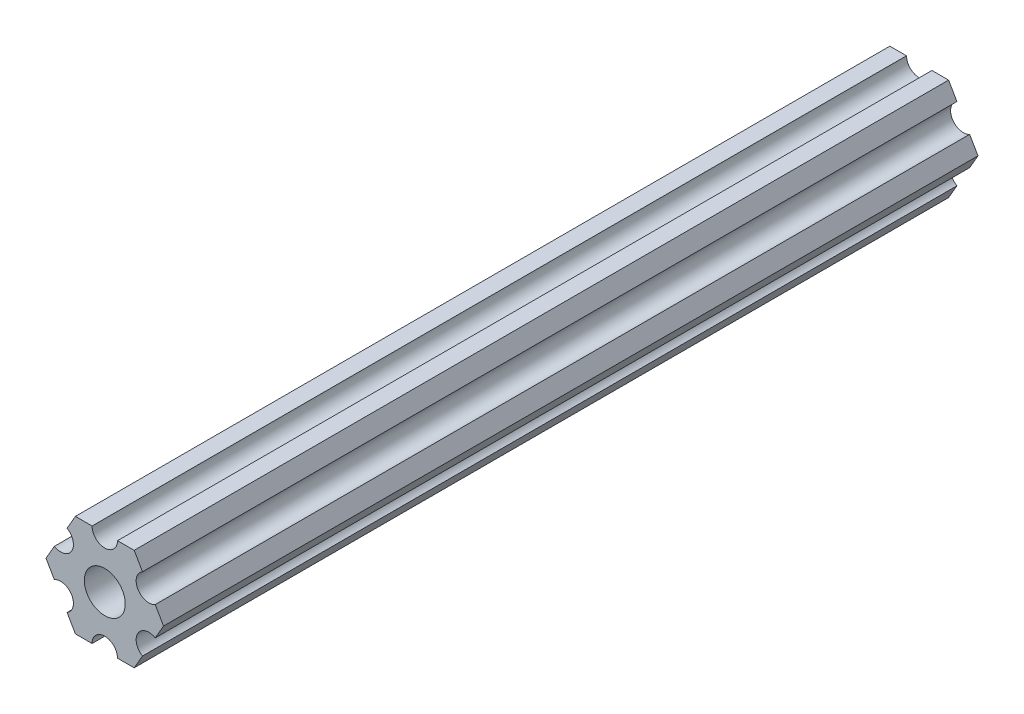
from build123d import *

# Parameters (mm, degrees)
BOSS_EXTRUDE1_DEPTH                         = 101.6
SKETCH2_R                                   = 1.5875
CUT_EXTRUDE1_DEPTH                          = 101.6
CBORE_FOR_10_SOCKET_HEAD_CAP_SCREW2_OUT_R   = 2.5527
CBORE_FOR_10_SOCKET_HEAD_CAP_SCREW2_OUT_R_2 = 1.5875
CBORE_FOR_10_SOCKET_HEAD_CAP_SCREW2_DEPTH   = 101.6


# Read off the part's stored shape, not the designer's step: CBORE for #10 Socket Head Cap Screw2
with BuildPart() as part:
    # Sketch1 → Boss-Extrude1 (new body)
    with BuildSketch(Plane.XY):
        with BuildLine():
            Line((-4.70551159, -4.549815043), (-3.666174521, -6.349999904))
            Line((-3.666174521, -6.349999904), (-1.587501923, -6.349999904))
            ThreePointArc((-1.587501923, -6.349999904), (-3.85e-07, -4.762498365), (1.587501923, -6.349999904))
            Line((1.587501923, -6.349999904), (3.666173825, -6.349999904))
            Line((3.666173825, -6.349999904), (4.705510929, -4.549815232))
            ThreePointArc((4.705510929, -4.549815232), (4.124445601, -2.381249904), (6.293010929, -1.800184575))
            Line((6.293010929, -1.800184575), (7.332348034, 9.6e-08))
            Line((7.332348034, 9.6e-08), (6.293011178, 1.800184715))
            ThreePointArc((6.293011178, 1.800184715), (4.124445902, 2.381250241), (4.705511428, 4.549815516))
            Line((4.705511428, 4.549815516), (3.666174521, 6.350000222))
            Line((3.666174521, 6.350000222), (1.587498077, 6.350000222))
            ThreePointArc((1.587498077, 6.350000222), (3.85e-07, 4.76250253), (-1.587498077, 6.350000222))
            Line((-1.587498077, 6.350000222), (-3.666173825, 6.350000222))
            Line((-3.666173825, 6.350000222), (-4.705511038, 4.549815614))
            ThreePointArc((-4.705511038, 4.549815614), (-4.124445841, 2.38125025), (-6.293011205, 1.800185053))
            Line((-6.293011205, 1.800185053), (-7.332348419, 4.44e-07))
            Line((-7.332348419, 4.44e-07), (-6.293011423, -1.80018429))
            ThreePointArc((-6.293011423, -1.80018429), (-4.12444613, -2.38124975), (-4.70551159, -4.549815043))
        make_face()
    extrude(amount=BOSS_EXTRUDE1_DEPTH)

    # Sketch2 → Cut-Extrude1 (cut)
    with BuildSketch(Plane.XY.offset(101.6)):
        Circle(SKETCH2_R)
    extrude(amount=-CUT_EXTRUDE1_DEPTH, mode=Mode.SUBTRACT)

    # CBORE for #10 Socket Head Cap Screw2 out → CBORE for #10 Socket Head Cap Screw2 (cut)
    with BuildSketch(Plane.XY):
        Circle(CBORE_FOR_10_SOCKET_HEAD_CAP_SCREW2_OUT_R)
        Circle(CBORE_FOR_10_SOCKET_HEAD_CAP_SCREW2_OUT_R_2, mode=Mode.SUBTRACT)
    extrude(amount=CBORE_FOR_10_SOCKET_HEAD_CAP_SCREW2_DEPTH, mode=Mode.SUBTRACT)


solid = part.part
